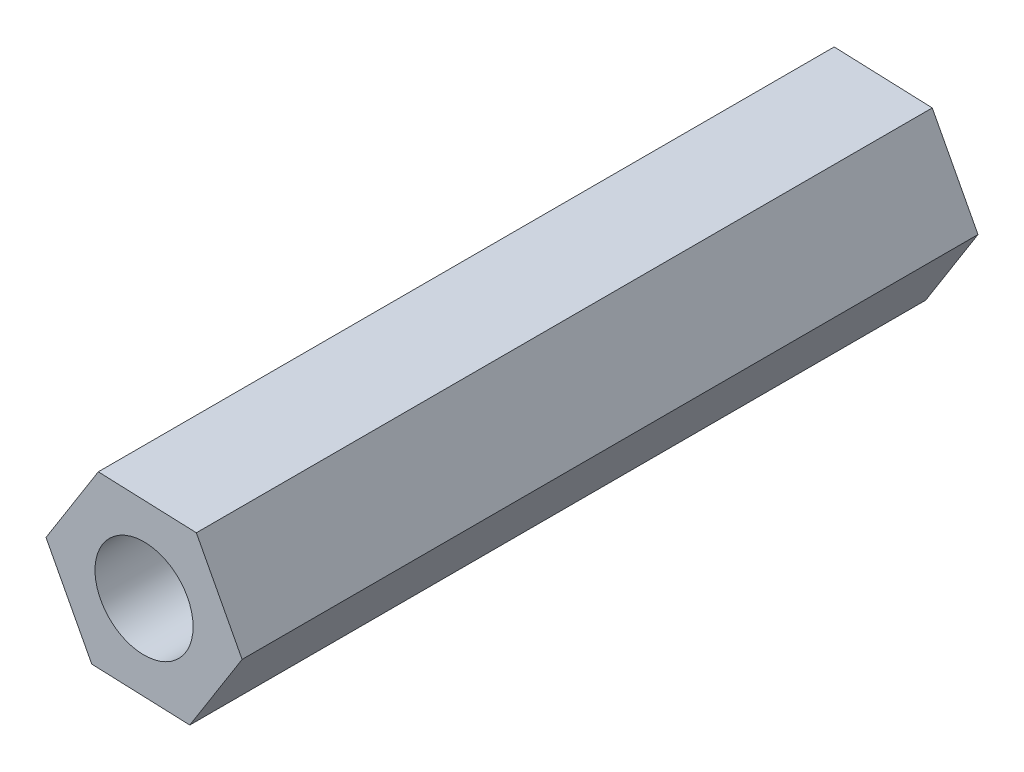
from build123d import *

# Parameters (mm, degrees)
SKETCH1_R           = 2
BOSS_EXTRUDE1_DEPTH = 30


with BuildPart() as part:
    # Sketch1 → Boss-Extrude1 (new body)
    with BuildSketch(Plane.XY):
        Polygon((5.073368063, -119.556817349), (1.07634995, -119.402395194), (-1.055892616, -122.786703341), (0.80888293, -126.325433645), (4.805901044, -126.4798558), (6.93814361, -123.095547653), align=None)
        with Locations((2.941125497, -122.941125497)):
            Circle(SKETCH1_R, mode=Mode.SUBTRACT)
    extrude(amount=BOSS_EXTRUDE1_DEPTH)


solid = part.part
